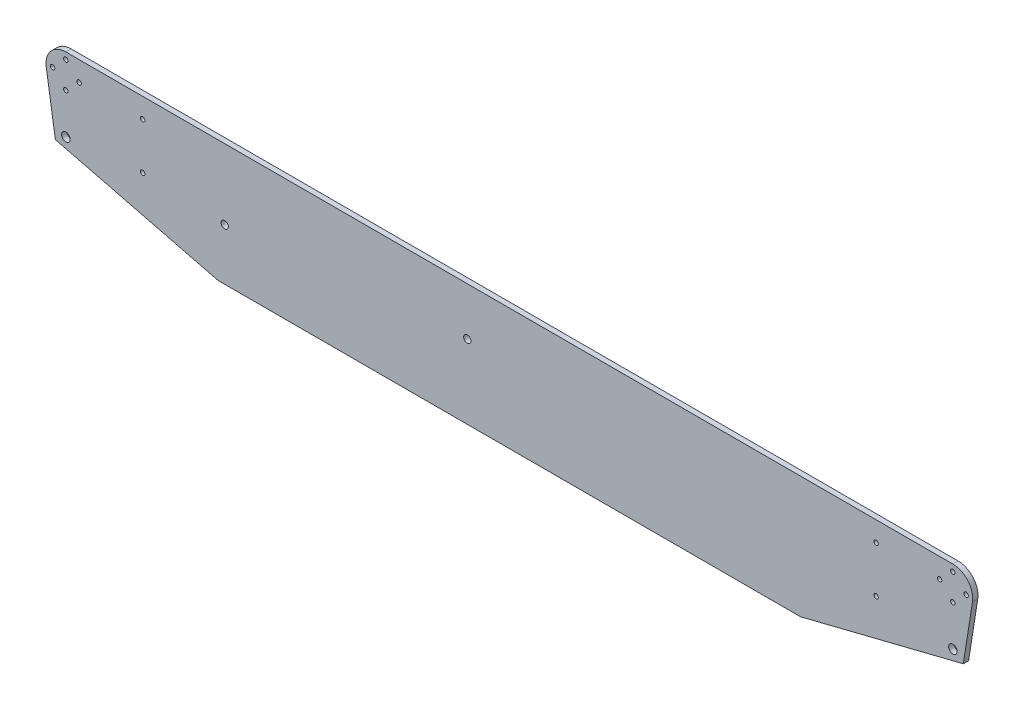
from build123d import *

# Parameters (mm, degrees)
SKETCH_1_R        = 3.25
EXTRUDE_1_DEPTH   = 4
HOLE_WIZARD_M32_D = 3.4
HOLE_WIZARD_M52_D = 5.5
HOLE_WIZARD_M33_D = 3.4
HOLE_WIZARD_M53_D = 5.5


with BuildPart() as part:
    # Эскиз1 → Бобышка-Вытянуть1 (new body)
    with BuildSketch(Plane.XY):
        with BuildLine():
            Line((-349.818316726, 28.672449915), (-342.910885265, -15.303620822))
            Line((-342.910885265, -15.303620822), (-220, -46))
            Line((-220, -46), (220, -46))
            Line((220, -46), (342.910885265, -15.303620822))
            Line((342.910885265, -15.303620822), (349.818316726, 28.672449915))
            ThreePointArc((349.818316726, 28.672449915), (346.399852001, 40.749019149), (335, 46))
            Line((335, 46), (-335, 46))
            ThreePointArc((-335, 46), (-346.399852001, 40.749019149), (-349.818316726, 28.672449915))
        make_face()
        with Locations((-335, -9.635315981)):
            Circle(SKETCH_1_R, mode=Mode.SUBTRACT)
        with Locations((335, -9.635315981)):
            Circle(SKETCH_1_R, mode=Mode.SUBTRACT)
    extrude(amount=EXTRUDE_1_DEPTH)

    # Отверстие с зазором M32 (through all)
    with Locations(Plane.XY.offset(4)):
        with Locations((-335, 41), (-345, 31), (-335, 21), (-325, 31), (325, 31), (335, 41), (345, 31), (335, 21)):
            Hole(HOLE_WIZARD_M32_D / 2)

    # Отверстие с зазором M52 (through all)
    with Locations(Plane(origin=(0, 0, 0), x_dir=(-1, 0, 0), z_dir=(0, 0, -1))):
        with Locations((215, -7)):
            Hole(HOLE_WIZARD_M52_D / 2)

    # Отверстие с зазором M33 (through all)
    with Locations(Plane(origin=(0, 0, 0), x_dir=(-1, 0, 0), z_dir=(0, 0, -1))):
        with Locations((-277, 31), (-277, -4), (277, -4), (277, 31)):
            Hole(HOLE_WIZARD_M33_D / 2)

    # Отверстие с зазором M53 (through all)
    with Locations(Plane(origin=(0, 0, 0), x_dir=(-1, 0, 0), z_dir=(0, 0, -1))):
        with Locations((31.771314746, 9.83)):
            Hole(HOLE_WIZARD_M53_D / 2)


solid = part.part
